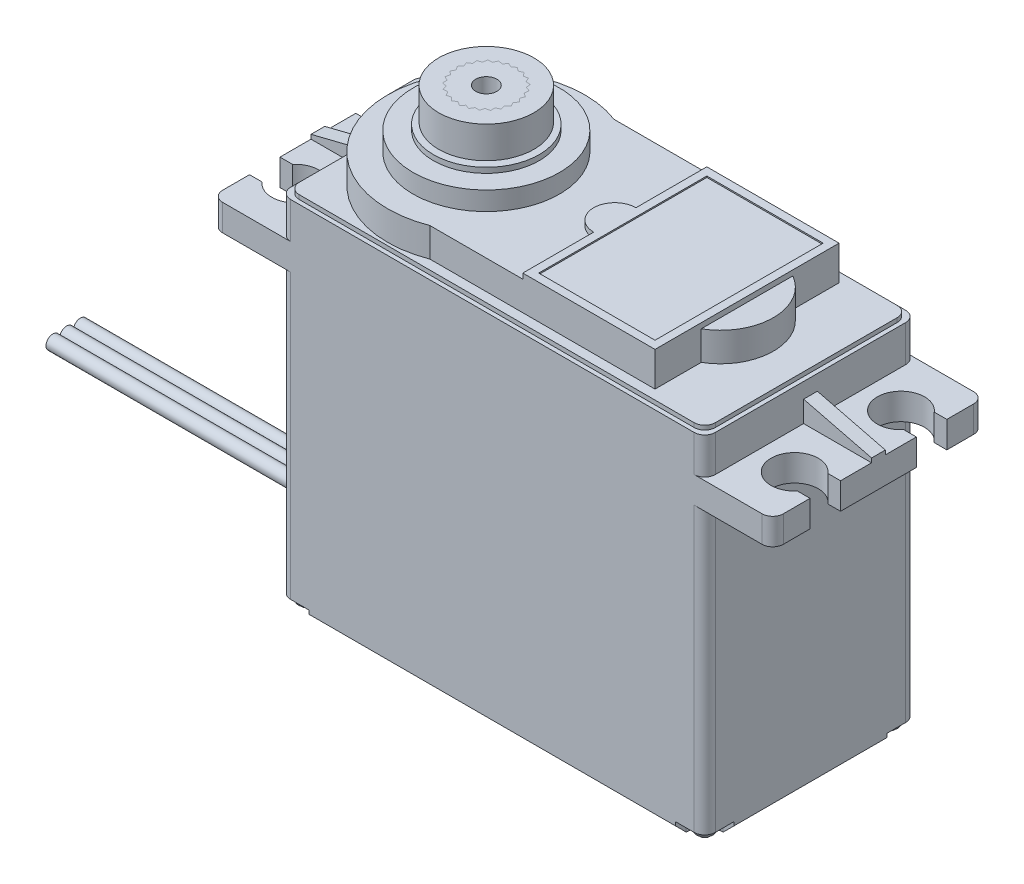
from build123d import *
from build123d.topology import SkipClean

# Parameters (mm, degrees)
SKETCH1_W               = 40.15
SKETCH1_H               = 20
BOSS_EXTRUDE1_DEPTH     = 34.5
SKETCH3_W               = 40.15
SKETCH3_H               = 20
SKETCH3_W_2             = 39.35
SKETCH3_H_2             = 19.2
CUT_EXTRUDE1_DEPTH      = 0.4
BOSS_EXTRUDE2_DEPTH     = 2.75
SKETCH4_R               = 6.925
BOSS_EXTRUDE3_DEPTH     = 1.77
SKETCH5_R               = 5
BOSS_EXTRUDE4_DEPTH     = 0.5
SKETCH6_W               = 11
SKETCH6_H               = 15.9
BOSS_EXTRUDE5_DEPTH     = 0.5
SKETCH7_W               = 11
SKETCH7_H               = 15.9
BOSS_EXTRUDE6_DEPTH     = 0.375
FILLET1_R               = 1
BOSS_EXTRUDE7_START     = 28.15
BOSS_EXTRUDE7_DEPTH     = 2.5
BOSS_EXTRUDE8_DEPTH     = 0.65
CUT_EXTRUDE2_START      = -1.35
CUT_EXTRUDE2_DEPTH      = 1.35
MIRROR2_START           = -1.35
MIRROR2_COPY_1_DEPTH    = 1.35
CHAMFER1_SIZE           = 1
BOSS_EXTRUDE9_DEPTH     = 3.18
BOSS_EXTRUDE11_DEPTH    = 25.18
SKETCH14_R              = 1
CUT_EXTRUDE4_DEPTH      = 3.18
CUT_EXTRUDE5_START      = 1
SKETCH20_W              = 0.5
SKETCH20_H              = 0.5
CUT_EXTRUDE5_DEPTH      = 0.5
MIRROR4_START           = 1
MIRROR4_COPY_2_SKETCH_W = 0.5
MIRROR4_COPY_2_SKETCH_H = 0.5
MIRROR4_COPY_2_DEPTH    = 0.5
SKETCH23_R              = 4.5
BOSS_EXTRUDE12_DEPTH    = 3


with BuildPart() as part:
    # Sketch1 → Boss-Extrude1 (new body)
    with BuildSketch(Plane(origin=(0, 0, 0), x_dir=(1, 0, 0), z_dir=(0, 1, 0))):
        Rectangle(SKETCH1_W, SKETCH1_H)
    extrude(amount=BOSS_EXTRUDE1_DEPTH)

    # Sketch3 → Cut-Extrude1 (cut)
    with BuildSketch(Plane(origin=(0, 34.5, 0), x_dir=(1, 0, 0), z_dir=(0, 1, 0))):
        Rectangle(SKETCH3_W, SKETCH3_H)
        Rectangle(SKETCH3_W_2, SKETCH3_H_2, mode=Mode.SUBTRACT)
    extrude(amount=-CUT_EXTRUDE1_DEPTH, mode=Mode.SUBTRACT)

    # Sketch2 → Boss-Extrude2 (add, symmetric)
    with BuildSketch(Plane(origin=(0, 34.5, 0), x_dir=(1, 0, 0), z_dir=(0, 1, 0))):
        with BuildLine():
            Line((14.075, -4.330127019), (14.075, -8.7))
            Line((14.075, -8.7), (-7.204703277, -8.7))
            ThreePointArc((-7.204703277, -8.7), (-19.905, 0), (-7.204703277, 8.7))
            Line((-7.204703277, 8.7), (14.075, 8.7))
            Line((14.075, 8.7), (14.075, 4.330127019))
            ThreePointArc((14.075, 4.330127019), (16.575, 0), (14.075, -4.330127019))
        make_face()
    extrude(amount=BOSS_EXTRUDE2_DEPTH, both=True)

    # Sketch4 → Boss-Extrude3 (add)
    with BuildSketch(Plane(origin=(0, 37.25, 0), x_dir=(1, 0, 0), z_dir=(0, 1, 0))):
        with Locations(Location((-10.575, 0, 0), (0, 0, 270))):
            Circle(SKETCH4_R)
    extrude(amount=BOSS_EXTRUDE3_DEPTH)

    # Sketch5 → Boss-Extrude4 (add)
    with BuildSketch(Plane(origin=(0, 39.02, 0), x_dir=(1, 0, 0), z_dir=(0, 1, 0))):
        with Locations(Location((-10.575, 0, 0), (0, 0, 270))):
            Circle(SKETCH5_R)
    extrude(amount=BOSS_EXTRUDE4_DEPTH)

    # Sketch6 → Boss-Extrude5 (add)
    with BuildSketch(Plane(origin=(0, 37.25, 0), x_dir=(1, 0, 0), z_dir=(0, 1, 0))):
        with BuildLine():
            Line((14.075, 8.7), (1.575, 8.7))
            Line((1.575, 8.7), (1.575, 2))
            ThreePointArc((1.575, 2), (-0.425, 0), (1.575, -2))
            Line((1.575, -2), (1.575, -8.7))
            Line((1.575, -8.7), (14.075, -8.7))
            Line((14.075, -8.7), (14.075, 8.7))
        make_face()
        with Locations((7.825, 0)):
            Rectangle(SKETCH6_W, SKETCH6_H, mode=Mode.SUBTRACT)
    extrude(amount=BOSS_EXTRUDE5_DEPTH)

    # Sketch7 → Boss-Extrude6 (add)
    with BuildSketch(Plane(origin=(0, 37.25, 0), x_dir=(1, 0, 0), z_dir=(0, 1, 0))):
        with Locations((7.825, 0)):
            Rectangle(SKETCH7_W, SKETCH7_H)
    extrude(amount=BOSS_EXTRUDE6_DEPTH)

    # Fillet1
    fillet1_edges = [part.edges().sort_by_distance(p)[0] for p in [
        (-20.075, 17.05, -10),
        (20.075, 17.05, -10),
        (20.075, 17.05, 10),
        (-20.075, 17.05, 10),
        (19.675, 34.3, -9.6),
        (19.675, 34.3, 9.6),
        (-19.675, 34.3, 9.6),
        (-19.675, 34.3, -9.6),
    ]]
    fillet(fillet1_edges, radius=FILLET1_R)

    # Sketch10 → Boss-Extrude7 (add)
    with BuildSketch(Plane(origin=(0, 0, 0), x_dir=(1, 0, 0), z_dir=(0, 1, 0)).offset(BOSS_EXTRUDE7_START)):
        with BuildLine():
            Line((-19.075, 10), (-25.5, 10))
            ThreePointArc((-25.5, 10), (-26.207106781, 9.707106781), (-26.5, 9))
            Line((-26.5, 9), (-26.5, 6.465))
            Line((-26.5, 6.465), (-25.309276163, 6.465))
            ThreePointArc((-25.309276163, 6.465), (-21.365, 5.025), (-25.309276163, 3.585))
            Line((-25.309276163, 3.585), (-26.5, 3.585))
            Line((-26.5, 3.585), (-26.5, -3.585))
            Line((-26.5, -3.585), (-25.309276163, -3.585))
            ThreePointArc((-25.309276163, -3.585), (-21.365, -5.025), (-25.309276163, -6.465))
            Line((-25.309276163, -6.465), (-26.5, -6.465))
            Line((-26.5, -6.465), (-26.5, -9))
            ThreePointArc((-26.5, -9), (-26.207106781, -9.707106781), (-25.5, -10))
            Line((-25.5, -10), (-19.075, -10))
            Line((-19.075, -10), (-19.075, 10))
        make_face()
        with BuildLine():
            Line((19.075, 10), (25.5, 10))
            ThreePointArc((25.5, 10), (26.207106781, 9.707106781), (26.5, 9))
            Line((26.5, 9), (26.5, 6.465))
            Line((26.5, 6.465), (25.309276163, 6.465))
            ThreePointArc((25.309276163, 6.465), (21.365, 5.025), (25.309276163, 3.585))
            Line((25.309276163, 3.585), (26.5, 3.585))
            Line((26.5, 3.585), (26.5, -3.585))
            Line((26.5, -3.585), (25.309276163, -3.585))
            ThreePointArc((25.309276163, -3.585), (21.365, -5.025), (25.309276163, -6.465))
            Line((25.309276163, -6.465), (26.5, -6.465))
            Line((26.5, -6.465), (26.5, -9))
            ThreePointArc((26.5, -9), (26.207106781, -9.707106781), (25.5, -10))
            Line((25.5, -10), (19.075, -10))
            Line((19.075, -10), (19.075, 10))
        make_face()
    extrude(amount=BOSS_EXTRUDE7_DEPTH)

    # Sketch11 → Boss-Extrude8 (add, symmetric)
    with BuildSketch(Plane.XY):
        Polygon((-20.075, 32.65), (-26.5, 31.04839424), (-26.5, 30.65), (-20.075, 30.65), align=None)
        Polygon((20.075, 32.65), (26.5, 31.04839424), (26.5, 30.65), (20.075, 30.65), align=None)
    extrude(amount=BOSS_EXTRUDE8_DEPTH, both=True)

    # Sketch12 → Cut-Extrude2 (cut)
    with BuildSketch(Plane.XZ.offset(CUT_EXTRUDE2_START)):
        with BuildLine():
            Line((17.325, 9), (17.325, 10))
            Line((17.325, 10), (19.075, 10))
            ThreePointArc((19.075, 10), (19.782106781, 9.707106781), (20.075, 9))
            Line((20.075, 9), (20.075, 7.25))
            Line((20.075, 7.25), (19.075, 7.25))
            ThreePointArc((19.075, 7.25), (17.837563133, 7.762563133), (17.325, 9))
        make_face()
    cut_extrude2 = extrude(amount=CUT_EXTRUDE2_DEPTH, mode=Mode.SUBTRACT)

    # Mirror1: Cut-Extrude2 across plane
    add(cut_extrude2.mirror(Plane.XY), mode=Mode.SUBTRACT)

    # Mirror2: Cut-Extrude2 across plane
    add(cut_extrude2.mirror(Plane(origin=(0, 0, 0), x_dir=(0, 0, 1), z_dir=(1, 0, 0))), mode=Mode.SUBTRACT)

    # Mirror2 copy 1 sketch → Mirror2 copy 1 (cut)
    with BuildSketch(Plane(origin=(0, 0, 0), x_dir=(-1, 0, 0), z_dir=(0, -1, 0)).offset(MIRROR2_START)):
        with BuildLine():
            Line((17.325, 9), (17.325, 10))
            Line((17.325, 10), (19.075, 10))
            ThreePointArc((19.075, 10), (19.782106781, 9.707106781), (20.075, 9))
            Line((20.075, 9), (20.075, 7.25))
            Line((20.075, 7.25), (19.075, 7.25))
            ThreePointArc((19.075, 7.25), (17.837563133, 7.762563133), (17.325, 9))
        make_face()
    extrude(amount=MIRROR2_COPY_1_DEPTH, mode=Mode.SUBTRACT)

    # Chamfer1
    chamfer1_edges = [part.edges().sort_by_distance(p)[0] for p in [
        (20.075, 0, 0),
        (0, 0, -10),
        (-20.075, 0, 0),
        (0, 0, 10),
    ]]
    chamfer(chamfer1_edges, length=CHAMFER1_SIZE)

    # Sketch13 → Boss-Extrude9 (add)
    with BuildSketch(Plane(origin=(0, 39.52, 0), x_dir=(1, 0, 0), z_dir=(0, 1, 0))):
        Polygon((-10.575, 2.935), (-10.911519732, 2.663827973), (-11.304904819, 2.842791578), (-11.563414424, 2.496449865), (-11.988947033, 2.571960106), (-12.153203402, 2.17221063), (-12.584145756, 2.139522921), (-12.643828057, 1.711483412), (-13.053102461, 1.572651643), (-13.004460636, 1.143217398), (-13.366350875, 0.906964878), (-13.212441268, 0.50311883), (-13.504208448, 0.184290175), (-13.254701766, -0.168592545), (-13.458013081, -0.549964158), (-13.128586746, -0.82971063), (-13.230667399, -1.249662221), (-12.84202048, -1.438694945), (-12.836456368, -1.87083941), (-12.413008979, -1.957280765), (-12.300149715, -2.374464878), (-11.868508615, -2.352883436), (-11.655445562, -2.728893986), (-11.242732347, -2.600645788), (-10.942853041, -2.911856648), (-10.575, -2.685), (-10.207146959, -2.911856648), (-9.907267653, -2.600645788), (-9.494554438, -2.728893986), (-9.281491385, -2.352883436), (-8.849850285, -2.374464878), (-8.736991021, -1.957280765), (-8.313543632, -1.87083941), (-8.30797952, -1.438694945), (-7.919332601, -1.249662221), (-8.021413254, -0.82971063), (-7.691986919, -0.549964158), (-7.895298234, -0.168592545), (-7.645791552, 0.184290175), (-7.937558732, 0.50311883), (-7.783649125, 0.906964878), (-8.145539364, 1.143217398), (-8.096897539, 1.572651643), (-8.506171943, 1.711483412), (-8.565854244, 2.139522921), (-8.996796598, 2.17221063), (-9.161052967, 2.571960106), (-9.586585576, 2.496449865), (-9.845095181, 2.842791578), (-10.238480268, 2.663827973), align=None)
    extrude(amount=BOSS_EXTRUDE9_DEPTH)

    # Sketch16 → Loft1 section 0
    with BuildSketch(Plane.ZY.offset(25.075)):
        with BuildLine():
            Line((-2.15, 1.75), (2.15, 1.75))
            Line((2.15, 1.75), (2.15, 3.25))
            Line((2.15, 3.25), (-2.15, 3.25))
            Line((-2.15, 3.25), (-2.15, 1.75))
        make_face()
    # Sketch15 → Loft1 section 1
    with BuildSketch(Plane.ZY.offset(20.075)):
        with BuildLine():
            Line((-2.9, 1), (2.9, 1))
            Line((2.9, 1), (2.9, 4))
            Line((2.9, 4), (-2.9, 4))
            Line((-2.9, 4), (-2.9, 1))
        make_face()
    loft()

    # Sketch17 → Boss-Extrude11 (add)
    with BuildSketch(Plane.ZY.offset(25.075)):
        with BuildLine():
            Line((0.637867541, 2.625), (0.662132459, 2.625))
            ThreePointArc((0.662132459, 2.625), (1.95, 2.5), (0.662132459, 2.375))
            Line((0.662132459, 2.375), (0.637867541, 2.375))
            ThreePointArc((0.637867541, 2.375), (0, 1.85), (-0.637867541, 2.375))
            Line((-0.637867541, 2.375), (-0.662132459, 2.375))
            ThreePointArc((-0.662132459, 2.375), (-1.95, 2.5), (-0.662132459, 2.625))
            Line((-0.662132459, 2.625), (-0.637867541, 2.625))
            ThreePointArc((-0.637867541, 2.625), (0, 3.15), (0.637867541, 2.625))
        make_face()
    extrude(amount=BOSS_EXTRUDE11_DEPTH)

    # Sketch14 → Cut-Extrude4 (cut)
    with BuildSketch(Plane(origin=(0, 42.7, 0), x_dir=(1, 0, 0), z_dir=(0, 1, 0))):
        with Locations(Location((-10.575, 0, 0), (0, 0, 270))):
            Circle(SKETCH14_R)
    extrude(amount=-CUT_EXTRUDE4_DEPTH, mode=Mode.SUBTRACT)

    # Sketch19 → Revolve1 (revolve)
    with SkipClean():  # the faces are left unmerged after this step: merging them gives an invalid solid
        with BuildSketch(Plane(origin=(18.809834957, 0, 0), x_dir=(0, 0, -1), z_dir=(1, 0, 0))):
            with BuildLine():
                Line((-8.734834957, 1.35), (-9.707106781, 1.35))
                ThreePointArc((-9.707106781, 1.35), (-9.422334957, 0.6625), (-8.734834957, 0.377728176))
                Line((-8.734834957, 0.377728176), (-8.734834957, 1.35))
            make_face()
            with BuildLine():
                Line((-7.762563133, 1.35), (-8.734834957, 1.35))
                Line((-8.734834957, 1.35), (-8.734834957, 0.377728176))
                ThreePointArc((-8.734834957, 0.377728176), (-8.047334957, 0.6625), (-7.762563133, 1.35))
            make_face()
        revolve1 = revolve(axis=Axis((18.809834957, 1.35, 8.734834957), (0, -1, 0)))
    add(part.part.scale(1), mode=Mode.REPLACE)  # the faces are merged on a copy

    # Sketch20 → Cut-Extrude5 (cut)
    with BuildSketch(Plane.XZ.offset(-1.35).offset(CUT_EXTRUDE5_START)):
        with Locations((18.809834957, 9.234834957)):
            Rectangle(SKETCH20_W, SKETCH20_H)
        with Locations((19.309834957, 8.734834957)):
            Rectangle(SKETCH20_W, SKETCH20_H)
        with Locations((18.809834957, 8.734834957)):
            Rectangle(SKETCH20_W, SKETCH20_H)
        with Locations((18.809834957, 8.234834957)):
            Rectangle(SKETCH20_W, SKETCH20_H)
        with Locations((18.309834957, 8.734834957)):
            Rectangle(SKETCH20_W, SKETCH20_H)
    cut_extrude5 = extrude(amount=-CUT_EXTRUDE5_DEPTH, mode=Mode.SUBTRACT)

    # Mirror3: Revolve1, Cut-Extrude5 across plane
    add(revolve1.mirror(Plane.XY))
    add(cut_extrude5.mirror(Plane.XY), mode=Mode.SUBTRACT)

    # Mirror4: Revolve1, Cut-Extrude5 across plane
    add(revolve1.mirror(Plane(origin=(0, 0, 0), x_dir=(0, 0, 1), z_dir=(1, 0, 0))))
    add(cut_extrude5.mirror(Plane(origin=(0, 0, 0), x_dir=(0, 0, 1), z_dir=(1, 0, 0))), mode=Mode.SUBTRACT)

    # Mirror4 copy 1 sketch → Mirror4 copy 1 (revolve)
    with SkipClean():  # the faces are left unmerged after this step: merging them gives an invalid solid
        with BuildSketch(Plane.ZY.offset(18.809834957)):
            with BuildLine():
                Line((-8.734834957, 1.35), (-9.707106781, 1.35))
                ThreePointArc((-9.707106781, 1.35), (-9.422334957, 0.6625), (-8.734834957, 0.377728176))
                Line((-8.734834957, 0.377728176), (-8.734834957, 1.35))
            make_face()
            with BuildLine():
                Line((-7.762563133, 1.35), (-8.734834957, 1.35))
                Line((-8.734834957, 1.35), (-8.734834957, 0.377728176))
                ThreePointArc((-8.734834957, 0.377728176), (-8.047334957, 0.6625), (-7.762563133, 1.35))
            make_face()
        revolve(axis=Axis((-18.809834957, 1.35, -8.734834957), (0, -1, 0)))
    add(part.part.scale(1), mode=Mode.REPLACE)  # the faces are merged on a copy

    # Mirror4 copy 2 sketch → Mirror4 copy 2 (cut)
    with BuildSketch(Plane(origin=(0, 1.35, 0), x_dir=(-1, 0, 0), z_dir=(0, -1, 0)).offset(MIRROR4_START)):
        with Locations((18.809834957, 9.234834957)):
            Rectangle(MIRROR4_COPY_2_SKETCH_W, MIRROR4_COPY_2_SKETCH_H)
        with Locations((19.309834957, 8.734834957)):
            Rectangle(MIRROR4_COPY_2_SKETCH_W, MIRROR4_COPY_2_SKETCH_H)
        with Locations((18.809834957, 8.734834957)):
            Rectangle(MIRROR4_COPY_2_SKETCH_W, MIRROR4_COPY_2_SKETCH_H)
        with Locations((18.809834957, 8.234834957)):
            Rectangle(MIRROR4_COPY_2_SKETCH_W, MIRROR4_COPY_2_SKETCH_H)
        with Locations((18.309834957, 8.734834957)):
            Rectangle(MIRROR4_COPY_2_SKETCH_W, MIRROR4_COPY_2_SKETCH_H)
    extrude(amount=-MIRROR4_COPY_2_DEPTH, mode=Mode.SUBTRACT)


with BuildPart() as body_2:
    # Sketch23 → Boss-Extrude12 (new body)
    with BuildSketch(Plane(origin=(0, 42.7, 0), x_dir=(1, 0, 0), z_dir=(0, 1, 0))):
        with Locations(Location((-10.575, 0, 0), (0, 0, 270))):
            Circle(SKETCH23_R)
        Polygon((-10.238480268, 2.663827973), (-10.575, 2.935), (-10.911519732, 2.663827973), (-11.304904819, 2.842791578), (-11.563414424, 2.496449865), (-11.988947033, 2.571960106), (-12.153203402, 2.17221063), (-12.584145756, 2.139522921), (-12.643828057, 1.711483412), (-13.053102461, 1.572651643), (-13.004460636, 1.143217398), (-13.366350875, 0.906964878), (-13.212441268, 0.50311883), (-13.504208448, 0.184290175), (-13.254701766, -0.168592545), (-13.458013081, -0.549964158), (-13.128586746, -0.82971063), (-13.230667399, -1.249662221), (-12.84202048, -1.438694945), (-12.836456368, -1.87083941), (-12.413008979, -1.957280765), (-12.300149715, -2.374464878), (-11.868508615, -2.352883436), (-11.655445562, -2.728893986), (-11.242732347, -2.600645788), (-10.942853041, -2.911856648), (-10.575, -2.685), (-10.207146959, -2.911856648), (-9.907267653, -2.600645788), (-9.494554438, -2.728893986), (-9.281491385, -2.352883436), (-8.849850285, -2.374464878), (-8.736991021, -1.957280765), (-8.313543632, -1.87083941), (-8.30797952, -1.438694945), (-7.919332601, -1.249662221), (-8.021413254, -0.82971063), (-7.691986919, -0.549964158), (-7.895298234, -0.168592545), (-7.645791552, 0.184290175), (-7.937558732, 0.50311883), (-7.783649125, 0.906964878), (-8.145539364, 1.143217398), (-8.096897539, 1.572651643), (-8.506171943, 1.711483412), (-8.565854244, 2.139522921), (-8.996796598, 2.17221063), (-9.161052967, 2.571960106), (-9.586585576, 2.496449865), (-9.845095181, 2.842791578), align=None, mode=Mode.SUBTRACT)
    extrude(amount=-BOSS_EXTRUDE12_DEPTH)


solid = Compound([part.part, body_2.part])
